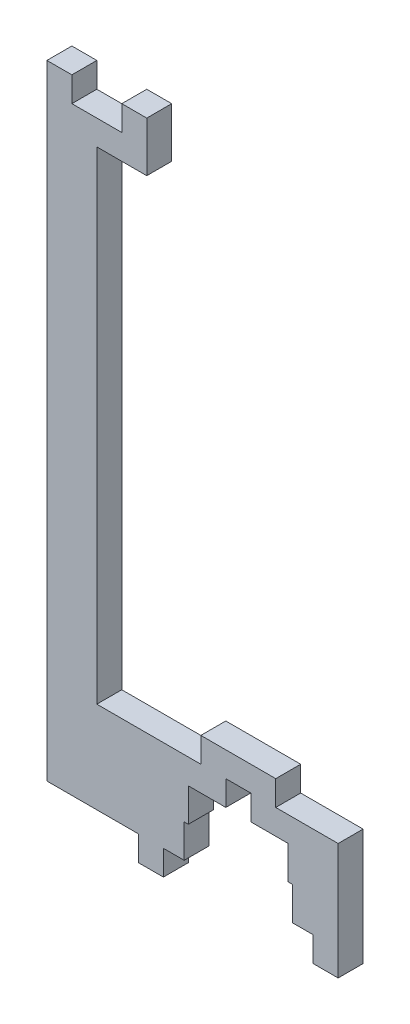
from build123d import *

# Parameters (mm, degrees)
SALIENTE_EXTRUIR1_DEPTH = 3


with BuildPart() as part:
    # Croquis1 → Saliente-Extruir1 (new body)
    with BuildSketch(Plane.XY):
        Polygon((17, -65), (17, -61), (12.5, -61), (12.5, -58), (9.5, -58), (9.5, -61), (5, -61), (5, -65), (4.5, -65), (4.5, -69), (2, -69), (2, -72), (-1, -72), (-1, -69), (-12, -69), (-12, 3), (-12, 6), (-9, 6), (-9, 3), (-3, 3), (-3, 6), (0, 6), (0, 0), (-6, 0), (-6, -58), (6.5, -58), (6.5, -55), (15.5, -55), (15.5, -58), (23, -58), (23, -69), (23, -72), (20, -72), (20, -69), (17.5, -69), (17.5, -65), align=None)
    extrude(amount=SALIENTE_EXTRUIR1_DEPTH)


solid = part.part
